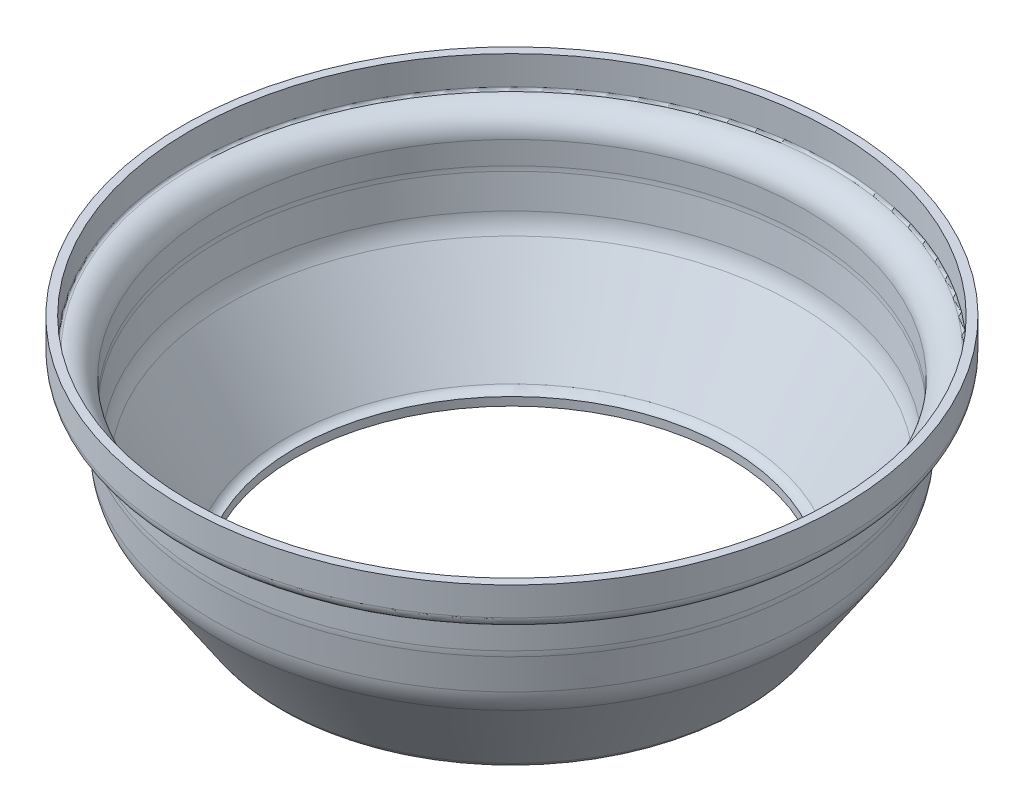
from build123d import *


# Read off the part's stored shape, not the designer's step: Thicken1
with BuildPart() as part:
    # Thicken1 outline → Thicken1 (revolve)
    with BuildSketch(Plane.XY):
        with BuildLine():
            ThreePointArc((94.874208517, 18.517297872), (93.276682166, 17.070656178), (91.186, 16.547291374))
            Line((91.186, 16.547291374), (91.186, 13.047291374))
            ThreePointArc((91.186, 13.047291374), (94.925670916, 13.983450953), (97.783218052, 16.571105814))
            Line((97.783218052, 16.571105814), (122.246455667, 53.136762929))
            ThreePointArc((122.246455667, 53.136762929), (124.382440282, 57.404541307), (125.39064134, 62.069291374))
            Line((125.39064134, 62.069291374), (126.585845332, 75.730535508))
            ThreePointArc((126.585845332, 75.730535508), (126.658324828, 76.836358935), (126.6825, 77.944291374))
            Line((126.6825, 77.944291374), (126.6825, 87.501121148))
            ThreePointArc((126.6825, 87.501121148), (128.772790503, 92.210407188), (133.6675, 93.819291374))
            ThreePointArc((133.6675, 93.819291374), (137.139237072, 94.987189383), (138.555289406, 98.365316059))
            Line((138.555289406, 98.365316059), (138.555289406, 110.365316059))
            Line((138.555289406, 110.365316059), (135.055289406, 110.365316059))
            Line((135.055289406, 110.365316059), (135.055289406, 98.298844467))
            ThreePointArc((135.055289406, 98.298844467), (134.766722462, 97.560568313), (134.0175, 97.301747404))
            ThreePointArc((134.0175, 97.301747404), (126.424919126, 94.806076658), (123.1825, 87.501121148))
            Line((123.1825, 87.501121148), (123.1825, 77.944291374))
            ThreePointArc((123.1825, 77.944291374), (123.161656053, 76.989026791), (123.099163888, 76.035580608))
            Line((123.099163888, 76.035580608), (121.903959897, 62.374336473))
            ThreePointArc((121.903959897, 62.374336473), (121.080992629, 58.566627101), (119.337446132, 55.082954987))
            Line((119.337446132, 55.082954987), (94.874208517, 18.517297872))
        make_face()
    revolve(axis=Axis((0, 0, 0), (0, 1, 0)))


solid = part.part
